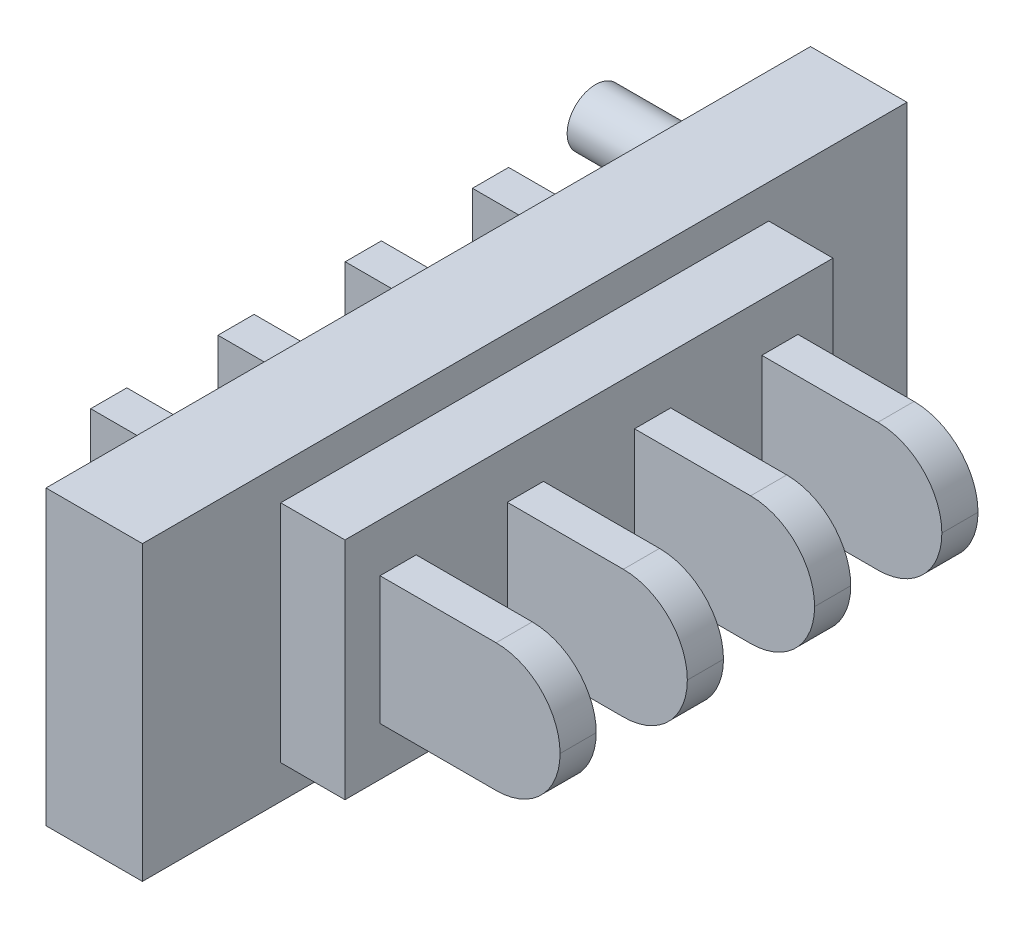
from build123d import *

# Parameters (mm, degrees)
ESQUISSE2_W        = 11.89
ESQUISSE2_H        = 4.55
BOSS_EXTRU_1_DEPTH = 1.5
ESQUISSE7_W        = 7.59
ESQUISSE7_H        = 3.5
BOSS_EXTRU_2_DEPTH = 1
ESQUISSE8_W        = 0.56222282
ESQUISSE8_H        = 1.99
BOSS_EXTRU_4_DEPTH = 7.3
CONG_6_R           = 0.995
ESQUISSE12_R       = 0.44
BOSS_EXTRU_5_DEPTH = 1.21


with BuildPart() as part:
    # Esquisse2 → Boss.-Extru.1 (new body)
    with BuildSketch(Plane(origin=(0, 0, 0), x_dir=(0, 0, -1), z_dir=(1, 0, 0))):
        with Locations((-5.945, 2.275)):
            Rectangle(ESQUISSE2_W, ESQUISSE2_H)
    extrude(amount=BOSS_EXTRU_1_DEPTH)

    # Esquisse7 → Boss.-Extru.2 (add)
    with BuildSketch(Plane(origin=(1.5, 0, 0), x_dir=(0, 0, -1), z_dir=(1, 0, 0))):
        with Locations((-5.945, 2.275)):
            Rectangle(ESQUISSE7_W, ESQUISSE7_H)
    extrude(amount=BOSS_EXTRU_2_DEPTH)

    # Esquisse8 → Boss.-Extru.4 (add)
    with BuildSketch(Plane(origin=(5.3, 0, 0), x_dir=(0, 0, -1), z_dir=(1, 0, 0))):
        with Locations((-6.93462953, 2.275)):
            Rectangle(ESQUISSE8_W, ESQUISSE8_H)
        with Locations((-2.97611141, 2.275)):
            Rectangle(ESQUISSE8_W, ESQUISSE8_H)
        with Locations((-8.91388859, 2.275)):
            Rectangle(ESQUISSE8_W, ESQUISSE8_H)
        with Locations((-4.95537047, 2.275)):
            Rectangle(ESQUISSE8_W, ESQUISSE8_H)
    extrude(amount=-BOSS_EXTRU_4_DEPTH)

    # Congé6
    cong_6_edges = [part.edges().sort_by_distance(p)[0] for p in [
        (5.3, 1.28, 2.97611141),
        (5.3, 1.28, 4.95537047),
        (5.3, 1.28, 6.93462953),
        (5.3, 1.28, 8.91388859),
        (5.3, 3.27, 8.91388859),
        (5.3, 3.27, 6.93462953),
        (5.3, 3.27, 4.95537047),
        (5.3, 3.27, 2.97611141),
    ]]
    fillet(cong_6_edges, radius=CONG_6_R - 0.0001)  # a hair under: the kernel refuses the full size

    # Esquisse12 → Boss.-Extru.5 (add)
    with BuildSketch(Plane.ZY):
        with Locations(Location((2.135, 4.06, 0), (0, 0, 180))):
            Circle(ESQUISSE12_R)
        with Locations(Location((9.755, 0.49, 0), (0, 0, 180))):
            Circle(ESQUISSE12_R)
    extrude(amount=BOSS_EXTRU_5_DEPTH)


solid = part.part
